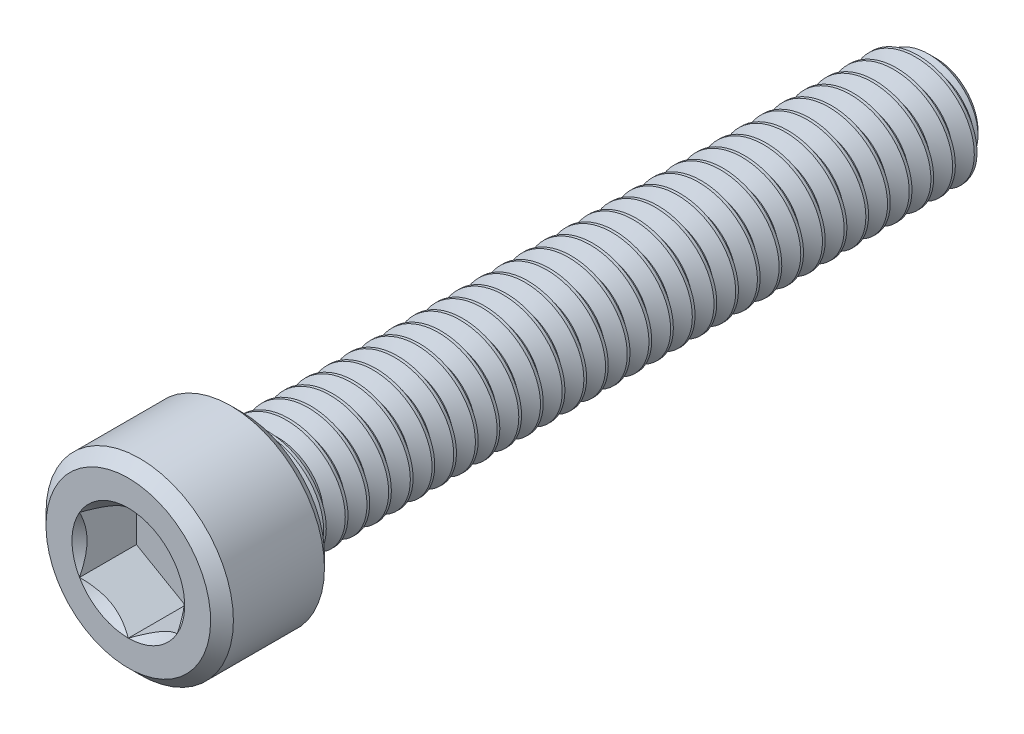
from build123d import *

# Parameters (mm, degrees)
CUT_EXTRUDE1_DEPTH = 2.0828
CUT_SWEEP1_PITCH   = 0.79375
CUT_SWEEP1_TO      = 25.4


with BuildPart() as part:
    # Sketch3 → Revolve1 (revolve)
    with BuildSketch(Plane(origin=(0, 0, 0), x_dir=(0, 0, -1), z_dir=(1, 0, 0))):
        Polygon((14.7828, 0), (-14.7828, 0), (-14.7828, 3.01244), (-14.36624, 3.429), (-11.03376, 3.429), (-10.6172, 3.01244), (-10.6172, 2.0828), (14.227175, 2.0828), (14.7828, 1.527175), align=None)
    revolve(axis=Axis((0, 0, -14.7828), (0, 0, 1)))

    # Sketch4 → Cut-Extrude1 (cut)
    with BuildSketch(Plane.XY.offset(14.7828)):
        Polygon((0, -2.062222993), (1.7859375, -1.031111496), (1.7859375, 1.031111496), (0, 2.062222993), (-1.7859375, 1.031111496), (-1.7859375, -1.031111496), align=None)
    extrude(amount=-CUT_EXTRUDE1_DEPTH, mode=Mode.SUBTRACT)

    # Cut-Extrude3 cone 1 section (through the dimple's axis) → Cut-Extrude3 (revolve, cut)
    with BuildSketch(Plane(origin=(0, 0, 14.7828), x_dir=(0, -1, 0), z_dir=(1, 0, 0))):
        Polygon((0, 0), (2.062222993, 0), (0, 2.062222993), align=None)
    revolve(axis=Axis((0, 0, 14.7828), (0, 0, -1)), mode=Mode.SUBTRACT)


with BuildPart() as body_2:
    # Split1: read off the stored shape, not the designer's step
    # Split1: the piece on the far side of the plane
    add(part.part)
    split(bisect_by=Plane.XY.offset(10.6172), keep=Keep.BOTTOM)

    # Cut-Sweep1: arcs per turn and ends read off the stored shape
    # Cut-Sweep1: the profile of Sketch7 screwed along a right-hand helix through 33 turns, 8 arcs to a turn; built about Z, then put on its axis
    cut_sweep1_z = Axis((0, 0, 0), (0, 0, 1))
    cut_sweep1_corners = [(2.125762979, 0, 0.024804688), (2.125762979, 0, -0.719335938), (1.567244252, 0, -0.396875), (1.567244252, 0, -0.29765625)]
    with BuildLine(mode=Mode.PRIVATE) as cut_sweep1_profile:
        Line(cut_sweep1_corners[0], cut_sweep1_corners[1])
        Line(cut_sweep1_corners[1], cut_sweep1_corners[2])
        Line(cut_sweep1_corners[2], cut_sweep1_corners[3])
        Line(cut_sweep1_corners[3], cut_sweep1_corners[0])
    cut_sweep1_cap = Face(cut_sweep1_profile.wire())
    cut_sweep1_turn_angles = [0, 22.5, 45, 67.5, 90, 112.5, 135, 157.5, 180, 202.5, 225, 247.5, 270, 292.5, 315, 337.5, 360]
    cut_sweep1_turn_weights = [1, 0.9238795325112867, 1, 0.9238795325112867, 1, 0.9238795325112867, 1, 0.9238795325112867, 1, 0.9238795325112867, 1, 0.9238795325112867, 1, 0.9238795325112867, 1, 0.9238795325112867, 1]
    cut_sweep1_turn_rails = [Edge.make_bspline([Vector(p[0], p[1], 0).rotate(cut_sweep1_z, cut_sweep1_turn_angles[k]) / cut_sweep1_turn_weights[k] + Vector(0, 0, p[2] + CUT_SWEEP1_PITCH * cut_sweep1_turn_angles[k] / 360) for k in range(17)], [0, 0, 0, 1, 1, 2, 2, 3, 3, 4, 4, 5, 5, 6, 6, 7, 7, 8, 8, 8], 2, cut_sweep1_turn_weights) for p in cut_sweep1_corners]
    cut_sweep1_turn_sides = [Face.make_surface_from_curves(cut_sweep1_turn_rails[p[0]], cut_sweep1_turn_rails[p[1]]) for p in [(0, 1), (1, 2), (2, 3), (3, 0)]]
    cut_sweep1 = Plane(origin=(0, 0, -14.7828), x_dir=(0, 1, 0), z_dir=(0, 0, 1)) * split(Solid(Shell([*[p.moved(Location((0, 0, CUT_SWEEP1_PITCH * i))) for i in range(33) for p in cut_sweep1_turn_sides], cut_sweep1_cap, cut_sweep1_cap.rotate(cut_sweep1_z, 11880).moved(Location((0, 0, CUT_SWEEP1_PITCH * 11880 / 360)))])), bisect_by=Plane.XY.offset(CUT_SWEEP1_TO), keep=Keep.BOTTOM, mode=Mode.PRIVATE)
    add(cut_sweep1, mode=Mode.SUBTRACT)


with BuildPart() as part_1:
    add(part.part)

    # Split1
    split(bisect_by=Plane.XY.offset(10.6172), keep=Keep.TOP)

    add(body_2.part)  # Boss-Extrude1 merges body 2
    # Boss-Extrude1: read off the stored shape, not the designer's step
    # Boss-Extrude1 outline → Boss-Extrude1 (revolve)
    with BuildSketch(Plane.XZ):
        Polygon((1.567243236, 10.6172), (1.567243236, 9.200719433), (2.0828, 10.6172), align=None)
    revolve(axis=Axis((0, 0, 0), (0, 0, 1)))


solid = part_1.part
